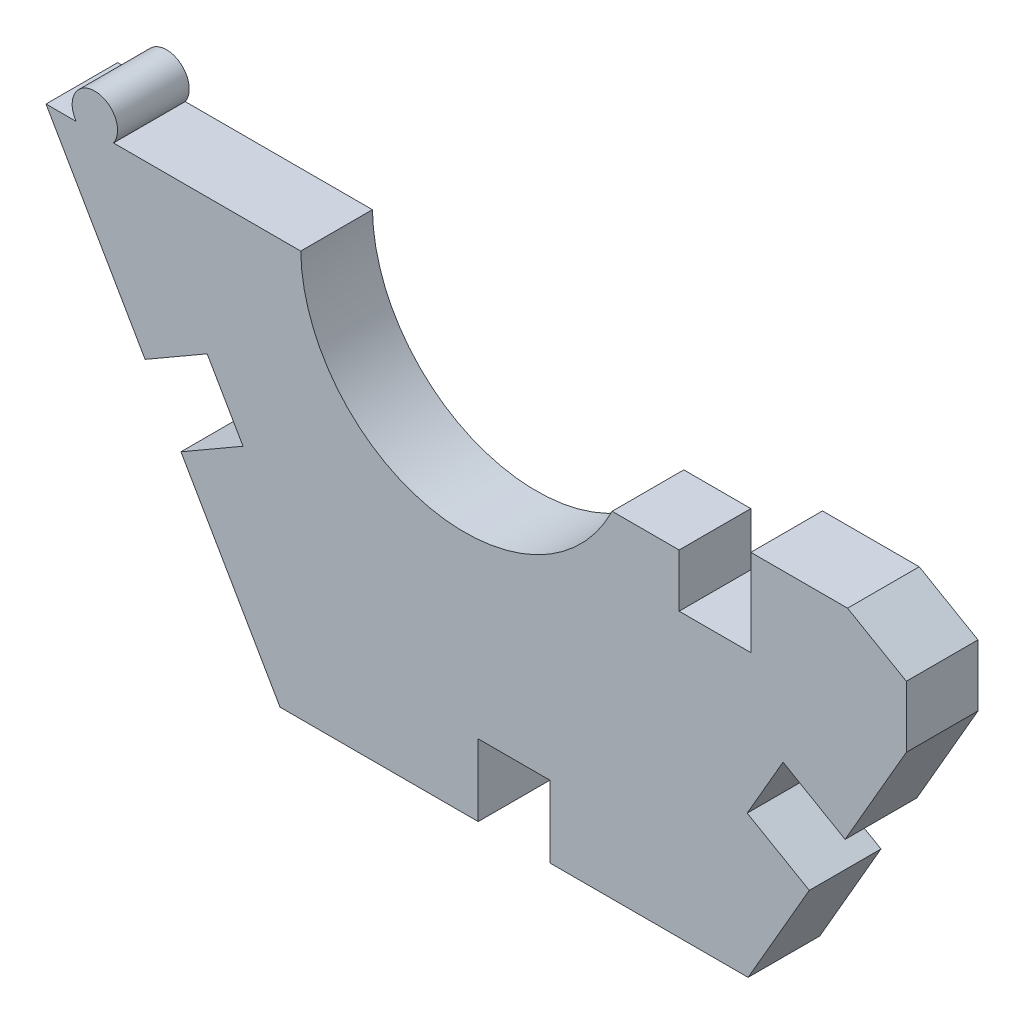
from build123d import *

# Parameters (mm, degrees)
BOSS_EXTRUDE1_DEPTH = 1.524


with BuildPart() as part:
    # Sketch1 → Boss-Extrude1 (new body)
    with BuildSketch(Plane.XY):
        with BuildLine():
            Line((-1.524, -3.370487407), (-1.524, -2.242816697))
            Line((-1.524, -2.242816697), (-2.948940421, -2.242816697))
            ThreePointArc((-2.948940421, -2.242816697), (-6.843010738, -4.114503547), (-9.568394246, -0.762))
            Line((-9.568394246, -0.762), (-13.548249122, -0.762))
            ThreePointArc((-13.548249122, -0.762), (-13.945094124, -0.0047788), (-14.341939127, -0.762))
            Line((-14.341939127, -0.762), (-14.983528559, -0.762))
            Line((-14.983528559, -0.762), (-12.876931855, -4.410732522))
            Line((-12.876931855, -4.410732522), (-11.557109139, -3.648732522))
            Line((-11.557109139, -3.648732522), (-10.795109139, -4.968555238))
            Line((-10.795109139, -4.968555238), (-12.114931855, -5.730555238))
            Line((-12.114931855, -5.730555238), (-10.008335151, -9.37928776))
            Line((-10.008335151, -9.37928776), (-5.795141743, -9.37928776))
            Line((-5.795141743, -9.37928776), (-5.795141743, -7.85528776))
            Line((-5.795141743, -7.85528776), (-4.271141743, -7.85528776))
            Line((-4.271141743, -7.85528776), (-4.271141743, -9.37928776))
            Line((-4.271141743, -9.37928776), (-0.057948335, -9.37928776))
            Line((-0.057948335, -9.37928776), (1.242798406, -7.126328317))
            Line((1.242798406, -7.126328317), (-0.077024309, -6.364328317))
            Line((-0.077024309, -6.364328317), (0.684975691, -5.044505601))
            Line((0.684975691, -5.044505601), (2.004798406, -5.806505601))
            Line((2.004798406, -5.806505601), (3.305545147, -3.553546158))
            Line((3.305545147, -3.553546158), (3.305545147, -2.245084323))
            Line((3.305545147, -2.245084323), (2.056590462, -1.524))
            Line((2.056590462, -1.524), (0, -1.524))
            Line((0, -1.524), (0, -3.370487407))
            Line((0, -3.370487407), (-1.524, -3.370487407))
        make_face()
    extrude(amount=BOSS_EXTRUDE1_DEPTH)


solid = part.part
